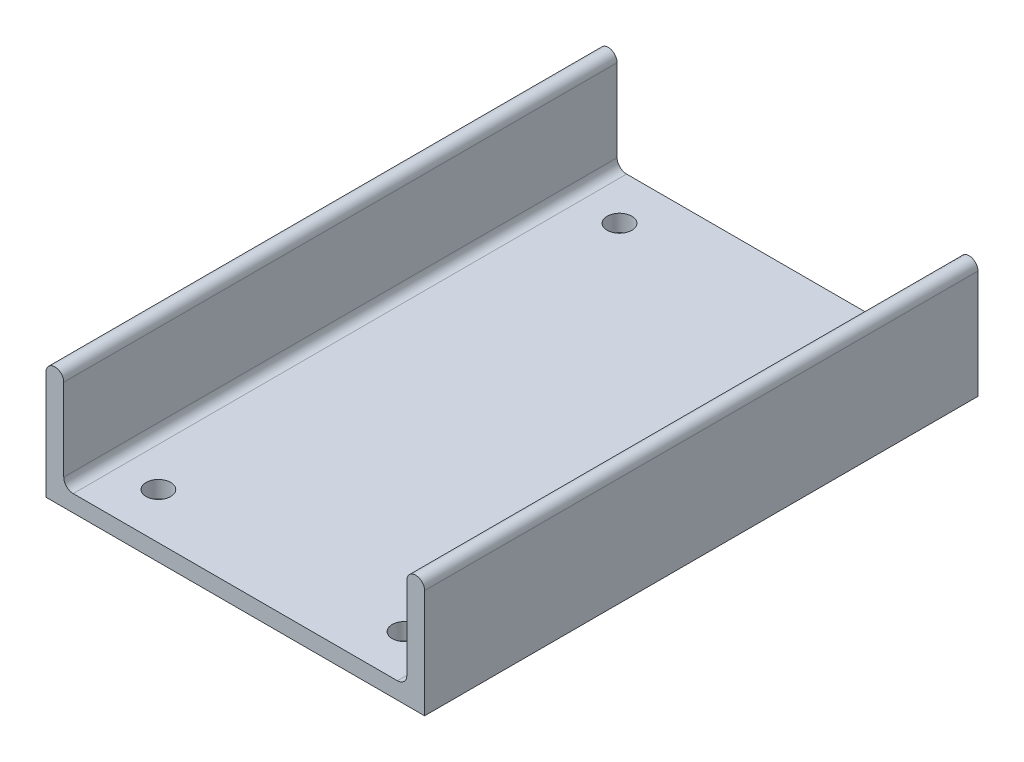
from build123d import *

# Parameters (mm, degrees)
EXTRUDE_THIN1_DEPTH  = 74.25436
FILLET1_RADIUS       = 2.38125
FILLET1_LENGTH       = 74.25436
FILLET2_R            = 2.54
MIRROR1_START        = -74.25436
MIRROR1_DEPTH        = 148.50872
M6_CLEARANCE_HOLE1_D = 6.6
CUT_EXTRUDE5_DEPTH   = 74.25436


# Read off the part's stored shape, not the designer's step: Mirror1
with BuildPart() as part:
    # Sketch4 → Extrude-Thin1 (new body)
    with BuildSketch(Plane.XY):
        Polygon((0, 0), (-50.8, 0), (-50.8, 31.75), (-46.0375, 31.75), (-46.0375, 4.7625), (0, 4.7625), align=None)
    extrude(amount=EXTRUDE_THIN1_DEPTH)

    # Fillet1: full round fillet: the end face becomes a half cylinder, R = half its width
    fillet1_face = Plane((-48.41875, 31.75, 37.12718), x_dir=(0, 0, -1), z_dir=(0, 1, 0))  # on the end face: x along it, z out of the body
    fillet1_slab = fillet1_face.offset(-FILLET1_RADIUS / 2) * Box(FILLET1_LENGTH, 2 * FILLET1_RADIUS, FILLET1_RADIUS, mode=Mode.PRIVATE)  # the body's end, R deep
    fillet1_round = Plane((-48.41875, 29.36875, 37.12718), x_dir=(0, 1, 0), z_dir=(0, 0, -1)) * Cylinder(FILLET1_RADIUS, FILLET1_LENGTH, mode=Mode.PRIVATE)  # its axis R under the face
    add(fillet1_slab - fillet1_round, mode=Mode.SUBTRACT)

    # Fillet2
    fillet2_edges = [part.edges().sort_by_distance(p)[0] for p in [
        (-46.0375, 4.7625, 37.12718),
    ]]
    fillet(fillet2_edges, radius=FILLET2_R)

    # Mirror1 outline → Mirror1 (add)
    with BuildSketch(Plane.XY.offset(MIRROR1_START)):
        with BuildLine():
            ThreePointArc((-46.0375, 29.36875), (-48.41875, 31.75), (-50.8, 29.36875))
            Line((-50.8, 29.36875), (-50.8, 0))
            Line((-50.8, 0), (50.8, 0))
            Line((50.8, 0), (50.8, 29.36875))
            ThreePointArc((50.8, 29.36875), (48.41875, 31.75), (46.0375, 29.36875))
            Line((46.0375, 29.36875), (46.0375, 7.3025))
            ThreePointArc((46.0375, 7.3025), (45.293551224, 5.506448776), (43.4975, 4.7625))
            Line((43.4975, 4.7625), (-43.4975, 4.7625))
            ThreePointArc((-43.4975, 4.7625), (-45.293551224, 5.506448776), (-46.0375, 7.3025))
            Line((-46.0375, 7.3025), (-46.0375, 29.36875))
        make_face()
    extrude(amount=MIRROR1_DEPTH)

    # M6 Clearance Hole1 (through all)
    with Locations(Plane(origin=(-33.02, 0, 61.87186), x_dir=(0, 0, -1), z_dir=(0, -1, 0))):
        with Locations((0, 0), (0, 66.04), (123.74372, 0), (123.74372, 66.04)):
            Hole(M6_CLEARANCE_HOLE1_D / 2)

    # Sketch12 → Cut-Extrude5 (cut, symmetric)
    with BuildSketch(Plane.XY):
        Polygon((-50.8, 0.254), (50.8, 0.254), (50.8, 0), (50.8, -4.927247647), (-50.8, -4.927247647), (-50.8, 0), align=None)
    extrude(amount=CUT_EXTRUDE5_DEPTH, both=True, mode=Mode.SUBTRACT)


solid = part.part
